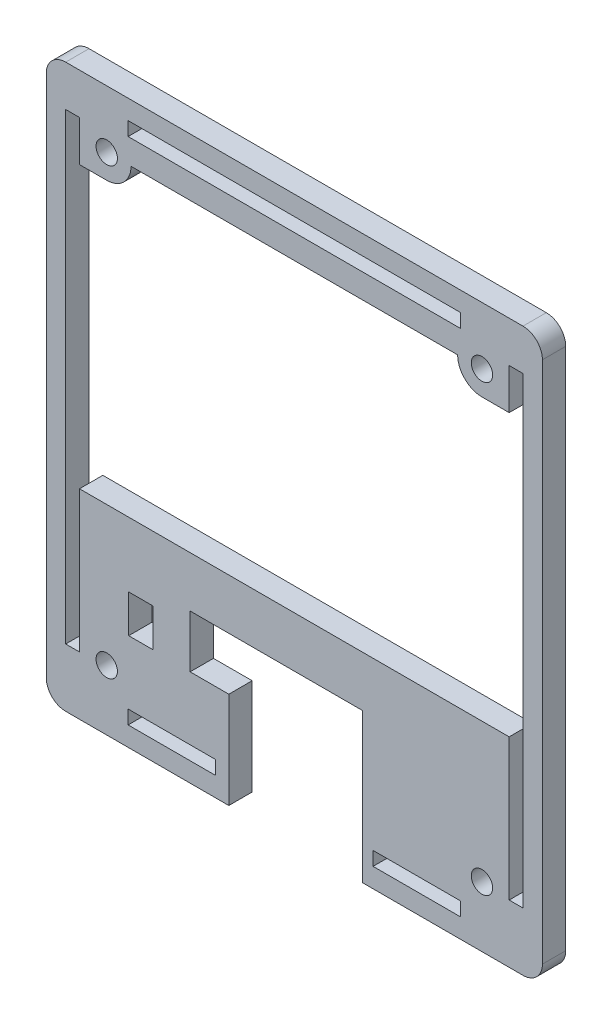
from build123d import *

# Parameters (mm, degrees)
SKETCH1_R           = 1.397
SKETCH1_W           = 3.175
SKETCH1_H           = 4.953
SKETCH1_W_2         = 11.43
SKETCH1_H_2         = 1.8034
SKETCH1_W_3         = 43.434
BOSS_EXTRUDE1_DEPTH = 3.048
FILLET1_R           = 2.54


with BuildPart() as part:
    # Sketch1 → Boss-Extrude1 (new body)
    with BuildSketch(Plane.XY):
        with BuildLine():
            ThreePointArc((-2.54, -1.8034), (-1.796051224, -3.599451224), (0, -4.3434))
            Line((0, -4.3434), (21.3106, -4.3434))
            Line((21.3106, -4.3434), (21.3106, 8.255))
            Line((21.3106, 8.255), (16.256, 8.255))
            Line((16.256, 8.255), (16.256, 15.1384))
            Line((16.256, 15.1384), (38.7858, 15.1384))
            Line((38.7858, 15.1384), (38.7858, -4.3434))
            Line((38.7858, -4.3434), (59.7408, -4.3434))
            ThreePointArc((59.7408, -4.3434), (61.536851224, -3.599451224), (62.2808, -1.8034))
            Line((62.2808, -1.8034), (62.2808, 69.1134))
            Line((62.2808, 69.1134), (-2.54, 69.1134))
            Line((-2.54, 69.1134), (-2.54, -1.8034))
        make_face()
        with Locations((5.3594, 3.556)):
            Circle(SKETCH1_R, mode=Mode.SUBTRACT)
        with Locations((9.8171, 10.8077)):
            Rectangle(SKETCH1_W, SKETCH1_H, mode=Mode.SUBTRACT)
        with Locations((13.8684, -0.9017)):
            Rectangle(SKETCH1_W_2, SKETCH1_H_2, mode=Mode.SUBTRACT)
        with Locations((45.8724, -0.9017)):
            Rectangle(SKETCH1_W_2, SKETCH1_H_2, mode=Mode.SUBTRACT)
        with Locations((54.3814, 3.556)):
            Circle(SKETCH1_R, mode=Mode.SUBTRACT)
        with Locations((5.3594, 61.595)):
            Circle(SKETCH1_R, mode=Mode.SUBTRACT)
        with Locations((29.8704, 65.6717)):
            Rectangle(SKETCH1_W_3, SKETCH1_H_2, mode=Mode.SUBTRACT)
        with BuildLine():
            Line((0, 63.754), (1.8034, 63.754))
            Line((1.8034, 63.754), (1.8034, 58.42))
            Line((1.8034, 58.42), (5.3594, 58.42))
            ThreePointArc((5.3594, 58.42), (7.60446403, 59.34993597), (8.5344, 61.595))
            Line((8.5344, 61.595), (51.2064, 61.595))
            ThreePointArc((51.2064, 61.595), (52.13633597, 59.34993597), (54.3814, 58.42))
            Line((54.3814, 58.42), (57.9374, 58.42))
            Line((57.9374, 58.42), (57.9374, 63.754))
            Line((57.9374, 63.754), (59.7408, 63.754))
            Line((59.7408, 63.754), (59.7408, 3.2766))
            Line((59.7408, 3.2766), (57.9374, 3.2766))
            Line((57.9374, 3.2766), (57.9374, 21.7424))
            Line((57.9374, 21.7424), (1.8034, 21.7424))
            Line((1.8034, 21.7424), (1.8034, 3.2766))
            Line((1.8034, 3.2766), (0, 3.2766))
            Line((0, 3.2766), (0, 63.754))
        make_face(mode=Mode.SUBTRACT)
        with Locations((54.3814, 61.595)):
            Circle(SKETCH1_R, mode=Mode.SUBTRACT)
    extrude(amount=BOSS_EXTRUDE1_DEPTH)

    # Fillet1
    fillet1_edges = [part.edges().sort_by_distance(p)[0] for p in [
        (-2.54, 69.1134, 1.524),
        (62.2808, 69.1134, 1.524),
    ]]
    fillet(fillet1_edges, radius=FILLET1_R)


solid = part.part
